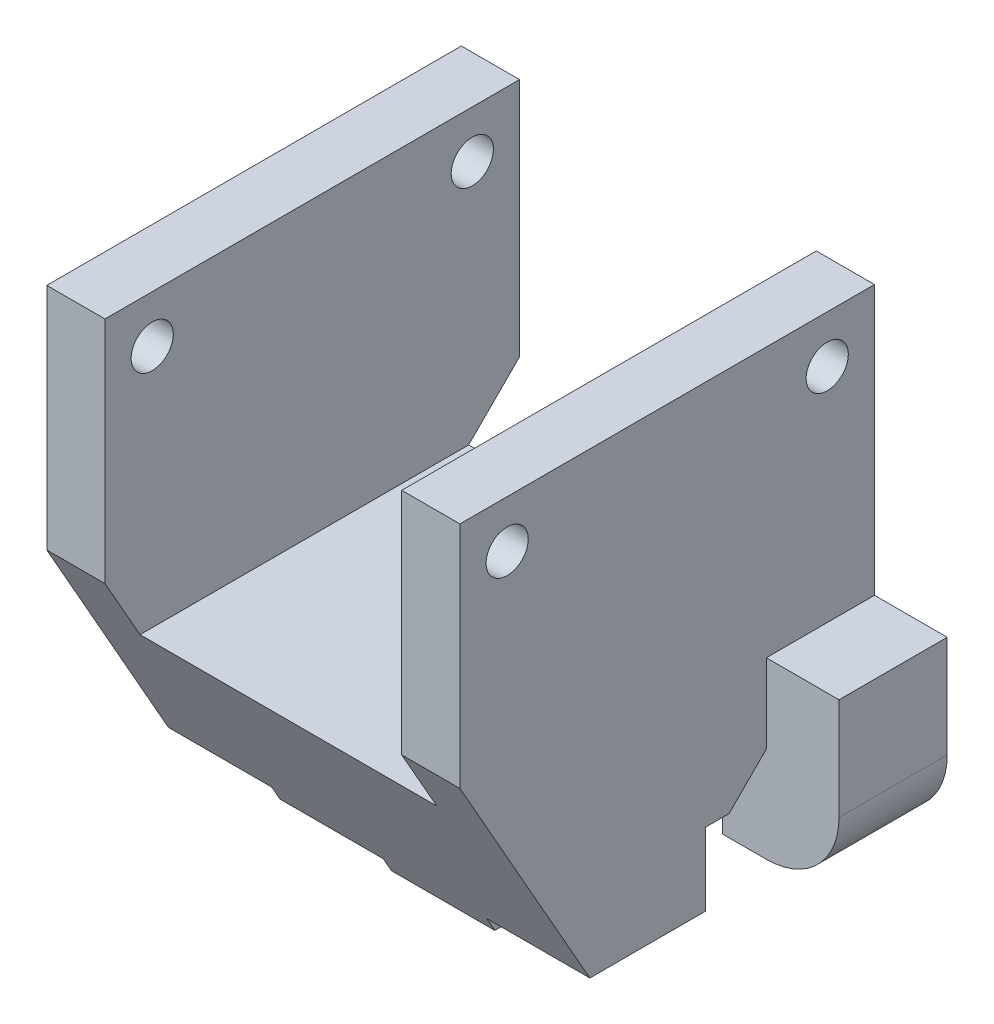
from build123d import *

# Parameters (mm, degrees)
SKETCH1_W                = 34
SKETCH1_H                = 46.5
BOSS_EXTRUDE1_DEPTH      = 28.5
SKETCH2_R                = 1.45
CUT_EXTRUDE1_DEPTH       = 51.088047476
SKETCH3_W                = 28.5
SKETCH3_H                = 20
CUT_EXTRUDE2_DEPTH       = 51.088047476
SKETCH4_W                = 26
SKETCH4_H                = 20
CUT_EXTRUDE3_DEPTH       = 41.519285532
BOSS_EXTRUDE2_DEPTH      = 5
BOSS_EXTRUDE2_DEPTH_BACK = 3
SKETCH5_W                = 7.437082776
SKETCH5_H                = 15
BOSS_EXTRUDE3_START      = 5.6
SKETCH6_W                = 28.5
SKETCH6_H                = 20
SKETCH6_R                = 1.45
BOSS_EXTRUDE3_DEPTH      = 5.6
SKETCH7_W                = 5.6
SKETCH7_H                = 26.5
CUT_EXTRUDE4_DEPTH       = 43.858050586
SKETCH9_W                = 7.1
SKETCH9_H                = 14
SKETCH9_H_2              = 16.896851025
BOSS_EXTRUDE4_DEPTH      = 4
SKETCH10_W               = 7.1
SKETCH10_H               = 17
BOSS_EXTRUDE5_DEPTH      = 1
SKETCH11_W               = 7.1
SKETCH11_H               = 19
BOSS_EXTRUDE6_DEPTH      = 2
SKETCH12_W               = 7.1
SKETCH12_H               = 16.896851025
BOSS_EXTRUDE7_DEPTH      = 1
CUT_EXTRUDE5_DEPTH       = 47.469048839
CUT_EXTRUDE5_DEPTH_BACK  = 47.469048839
SKETCH13_W               = 7.437082776
SKETCH13_H               = 3
FILLET1_R                = 5
CHAMFER1_START           = -11.4
CHAMFER1_DEPTH           = 25.4
CHAMFER1_START_2         = 9.9
CHAMFER1_2_DEPTH         = 12.1
CHAMFER1_3_DEPTH         = 14.2


with BuildPart() as part:
    # Sketch1 → Boss-Extrude1 (new body)
    with BuildSketch(Plane.XY):
        Rectangle(SKETCH1_W, SKETCH1_H)
    extrude(amount=BOSS_EXTRUDE1_DEPTH)

    # Sketch2 → Cut-Extrude1 (cut, through all)
    with BuildSketch(Plane(origin=(17, 0, 0), x_dir=(0, 0, -1), z_dir=(1, 0, 0))):
        with Locations(Location((-25.25, 20, 0), (0, 0, 90))):
            Circle(SKETCH2_R)
        with Locations(Location((-3.25, 20, 0), (0, 0, 90))):
            Circle(SKETCH2_R)
        with Locations(Location((-3.25, -20, 0), (0, 0, 90))):
            Circle(SKETCH2_R)
        with Locations(Location((-25.25, -20, 0), (0, 0, 90))):
            Circle(SKETCH2_R)
    extrude(amount=-CUT_EXTRUDE1_DEPTH, mode=Mode.SUBTRACT)

    # Sketch3 → Cut-Extrude2 (cut, through all)
    with BuildSketch(Plane(origin=(17, 0, 0), x_dir=(0, 0, -1), z_dir=(1, 0, 0))):
        with Locations((-14.25, -13.25)):
            Rectangle(SKETCH3_W, SKETCH3_H)
    extrude(amount=-CUT_EXTRUDE2_DEPTH, mode=Mode.SUBTRACT)

    # Sketch4 → Cut-Extrude3 (cut, through all)
    with BuildSketch(Plane(origin=(0, 0, 0), x_dir=(-1, 0, 0), z_dir=(0, 0, -1))):
        with Locations((0, 13.25)):
            Rectangle(SKETCH4_W, SKETCH4_H)
    extrude(amount=-CUT_EXTRUDE3_DEPTH, mode=Mode.SUBTRACT)

    # Sketch5 → Boss-Extrude2 (add, two sides: drawn at the far end of the back side and taken through both)
    with BuildSketch(Plane(origin=(17, 0, 0), x_dir=(0, 0, -1), z_dir=(1, 0, 0)).offset(-BOSS_EXTRUDE2_DEPTH_BACK)):
        with Locations((-3.718541388, -2.75)):
            Rectangle(SKETCH5_W, SKETCH5_H)
    extrude(amount=BOSS_EXTRUDE2_DEPTH + BOSS_EXTRUDE2_DEPTH_BACK)

    # Sketch6 → Boss-Extrude3 (add)
    with BuildSketch(Plane(origin=(-13, 0, 0), x_dir=(0, 0, -1), z_dir=(1, 0, 0)).offset(BOSS_EXTRUDE3_START)):
        with Locations((-14.25, 13.25)):
            Rectangle(SKETCH6_W, SKETCH6_H)
        with Locations(Location((-25.25, 20, 0), (0, 0, 90))):
            Circle(SKETCH6_R, mode=Mode.SUBTRACT)
        with Locations(Location((-3.25, 20, 0), (0, 0, 90))):
            Circle(SKETCH6_R, mode=Mode.SUBTRACT)
    extrude(amount=-BOSS_EXTRUDE3_DEPTH)

    # Sketch7 → Cut-Extrude4 (cut, through all)
    with BuildSketch(Plane(origin=(0, 0, 0), x_dir=(-1, 0, 0), z_dir=(0, 0, -1))):
        with Locations((14.2, 10)):
            Rectangle(SKETCH7_W, SKETCH7_H)
    extrude(amount=-CUT_EXTRUDE4_DEPTH, mode=Mode.SUBTRACT)

    # Sketch9 → Boss-Extrude4 (add)
    with BuildSketch(Plane.XZ.offset(3.25)):
        with Locations((-7.85, 21.5)):
            Rectangle(SKETCH9_W, SKETCH9_H)
        Polygon((2.8, 28.5), (-4.3, 28.5), (-4.3, 14.5), (-4.3, 11.5), (2.8, 11.5), align=None)
        with Locations((13.45, 20.051574487)):
            Rectangle(SKETCH9_W, SKETCH9_H_2)
        Polygon((9.9, 28.5), (2.8, 28.5), (2.8, 11.5), (2.8, 9.5), (9.9, 9.5), (9.9, 11.603148975), align=None)
    extrude(amount=BOSS_EXTRUDE4_DEPTH)

    # Sketch10 → Boss-Extrude5 (add)
    with BuildSketch(Plane.XZ.offset(7.25)):
        with Locations((-0.75, 20)):
            Rectangle(SKETCH10_W, SKETCH10_H)
    extrude(amount=BOSS_EXTRUDE5_DEPTH)

    # Sketch11 → Boss-Extrude6 (add)
    with BuildSketch(Plane.XZ.offset(7.25)):
        with Locations((6.35, 19)):
            Rectangle(SKETCH11_W, SKETCH11_H)
    extrude(amount=BOSS_EXTRUDE6_DEPTH)

    # Sketch12 → Boss-Extrude7 (add)
    with BuildSketch(Plane.XZ.offset(7.25)):
        with Locations((13.45, 20.051574487)):
            Rectangle(SKETCH12_W, SKETCH12_H)
    extrude(amount=BOSS_EXTRUDE7_DEPTH)

    # Sketch13 → Cut-Extrude5 (cut, two sides: drawn at the far end of the back side and taken through both)
    with BuildSketch(Plane(origin=(17, 0, 0), x_dir=(0, 0, -1), z_dir=(1, 0, 0)).offset(-CUT_EXTRUDE5_DEPTH_BACK)):
        Polygon((-19, -9.25), (-28.5, 7.5), (-28.5, -9.25), align=None)
        with Locations((-3.718541388, -8.75)):
            Rectangle(SKETCH13_W, SKETCH13_H)
    extrude(amount=CUT_EXTRUDE5_DEPTH + CUT_EXTRUDE5_DEPTH_BACK, mode=Mode.SUBTRACT)

    # Fillet1
    fillet1_edges = [part.edges().sort_by_distance(p)[0] for p in [
        (22, -7.25, 3.718541388),
    ]]
    fillet(fillet1_edges, radius=FILLET1_R)

    # Chamfer1: read off the stored shape, not the designer's step
    # Chamfer1 outline → Chamfer1 (cut)
    with BuildSketch(Plane.YZ.offset(CHAMFER1_START)):
        Polygon((-2.75, 9.5), (-3.25, 9.5), (-3.25, 0), (6.75, 0), align=None)
    extrude(amount=CHAMFER1_DEPTH, mode=Mode.SUBTRACT)

    # Chamfer1 2 outline → Chamfer1 2 (cut)
    with BuildSketch(Plane.YZ.offset(CHAMFER1_START_2)):
        Polygon((-3.25, 7.437082776), (-0.687082776, 7.437082776), (-3.25, 10), align=None)
    extrude(amount=CHAMFER1_2_DEPTH, mode=Mode.SUBTRACT)

    # Chamfer1 3 outline → Chamfer1 3 (cut)
    with BuildSketch(Plane.YZ.offset(CHAMFER1_START)):
        Polygon((-3.25, 9.5), (-2.75, 9.5), (-3.25, 10), align=None)
    extrude(amount=CHAMFER1_3_DEPTH, mode=Mode.SUBTRACT)


solid = part.part
